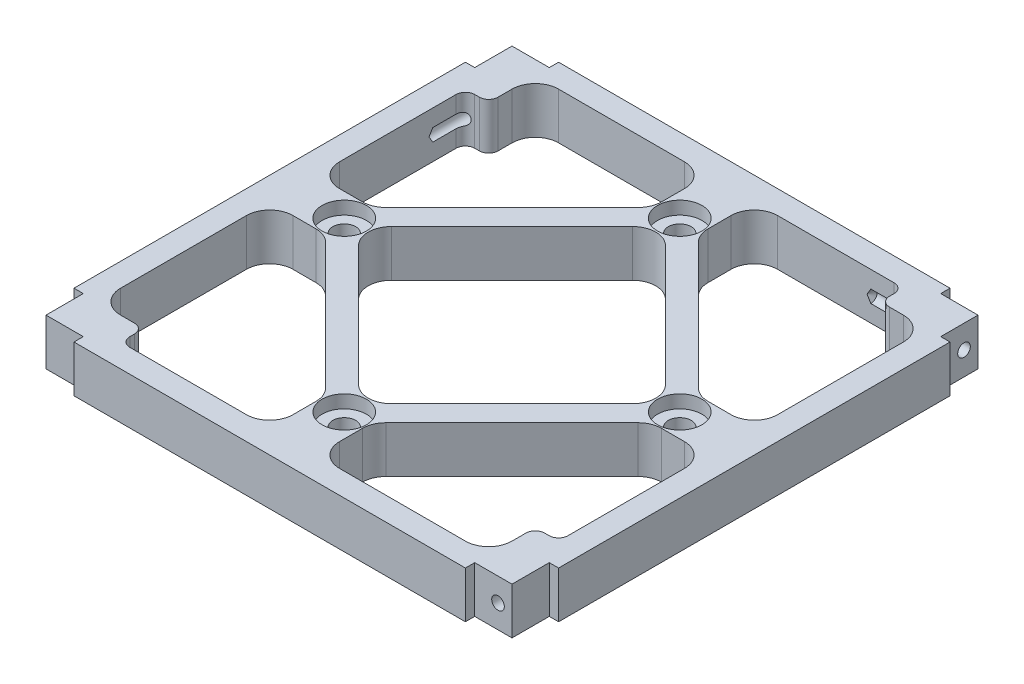
from build123d import *

# Parameters (mm, degrees)
SKETCH1_W                                           = 104
SKETCH1_H                                           = 104
BOSS_EXTRUDE1_DEPTH                                 = 10
FILLET1_R                                           = 5
CUT_EXTRUDE1_DEPTH                                  = 75.215901261
CIRPATTERN1_COUNT                                   = 4
CBORE_FOR_6_BINDING_HEAD_MACHINE_SCREW1_D           = 4.9149
CBORE_FOR_6_BINDING_HEAD_MACHINE_SCREW1_CBORE_D     = 9.525
CBORE_FOR_6_BINDING_HEAD_MACHINE_SCREW1_CBORE_DEPTH = 2.794
FILLET3_R                                           = 2
CIRPATTERN5_COUNT                                   = 4


with BuildPart() as part:
    # Sketch1 → Boss-Extrude1 (new body)
    with BuildSketch(Plane(origin=(0, 0, 0), x_dir=(1, 0, 0), z_dir=(0, 1, 0))):
        Rectangle(SKETCH1_W, SKETCH1_H)
        Polygon((-42, 47), (-42, 37), (-47, 37), (-47, 5), (-35, 5), (-5, 35), (-5, 47), align=None, mode=Mode.SUBTRACT)
        Polygon((-32.928932188, 0), (0, 32.928932188), (32.928932188, 0), (0, -32.928932188), align=None, mode=Mode.SUBTRACT)
        Polygon((5, 47), (5, 35), (35, 5), (47, 5), (47, 42), (37, 42), (37, 47), align=None, mode=Mode.SUBTRACT)
        Polygon((47, -5), (35, -5), (5, -35), (5, -47), (42, -47), (42, -37), (47, -37), align=None, mode=Mode.SUBTRACT)
        Polygon((-5, -47), (-5, -35), (-35, -5), (-47, -5), (-47, -42), (-37, -42), (-37, -47), align=None, mode=Mode.SUBTRACT)
    extrude(amount=BOSS_EXTRUDE1_DEPTH)

    # Fillet1
    fillet1_edges = [part.edges().sort_by_distance(p)[0] for p in [
        (32.928932188, 5, 0),
        (0, 5, 32.928932188),
        (-32.928932188, 5, 0),
        (0, 5, -32.928932188),
        (-5, 5, -47),
        (-5, 5, -35),
        (-35, 5, -5),
        (-47, 5, 42),
        (-47, 5, 5),
        (-35, 5, 5),
        (-5, 5, 35),
        (-5, 5, 47),
        (42, 5, 47),
        (47, 5, 5),
        (35, 5, 5),
        (5, 5, 35),
        (5, 5, 47),
        (47, 5, -42),
        (47, 5, -5),
        (35, 5, -5),
        (5, 5, -35),
        (5, 5, -47),
        (-42, 5, -47),
        (-47, 5, -5),
    ]]
    fillet(fillet1_edges, radius=FILLET1_R)

    # Sketch2 → Cut-Extrude1 (cut, through all)
    with BuildSketch(Plane(origin=(0, 10, 0), x_dir=(1, 0, 0), z_dir=(0, 1, 0))):
        Polygon((-52, 52), (-42, 52), (-42, 50), (-50, 50), (-50, 42), (-52, 42), align=None)
    cut_extrude1 = extrude(amount=-CUT_EXTRUDE1_DEPTH, mode=Mode.SUBTRACT)

    # CirPattern1: Cut-Extrude1 ×4 about axis
    cirpattern1_axis = Axis((0, 10.5, 0), (0, -1, 0))
    for i in range(1, CIRPATTERN1_COUNT):
        add(cut_extrude1.rotate(cirpattern1_axis, i * 360 / CIRPATTERN1_COUNT), mode=Mode.SUBTRACT)

    # CBORE for #6 Binding Head Machine Screw1 (through all)
    with Locations(Plane(origin=(0, 10, 0), x_dir=(1, 0, 0), z_dir=(0, 1, 0))):
        with Locations((0, 36), (-36, 0), (0, -36), (36, 0)):
            CounterBoreHole(CBORE_FOR_6_BINDING_HEAD_MACHINE_SCREW1_D / 2, CBORE_FOR_6_BINDING_HEAD_MACHINE_SCREW1_CBORE_D / 2, CBORE_FOR_6_BINDING_HEAD_MACHINE_SCREW1_CBORE_DEPTH)

    # Fillet3
    fillet3_edges = [part.edges().sort_by_distance(p)[0] for p in [
        (-37, 5, 42),
        (-37, 5, 47),
        (42, 5, 37),
        (47, 5, 37),
        (37, 5, -42),
        (37, 5, -47),
        (-47, 5, -37),
        (-42, 5, -37),
    ]]
    fillet(fillet3_edges, radius=FILLET3_R)

    # Sketch9 → #6-32 Tapped Hole1 (revolve, cut)
    with BuildSketch(Plane(origin=(50, 5, -47), x_dir=(0, 0, -1), z_dir=(0, 1, 0))):
        Polygon((0, 0), (0, 20.81269403), (1.35255, 20), (1.35255, 0), align=None)
    f_6_32_tapped_hole1 = revolve(axis=Axis((56.35, 5, -47), (-1, 0, 0)), mode=Mode.SUBTRACT)

    # CirPattern5: #6-32 Tapped Hole1 ×4 about axis
    cirpattern5_axis = Axis((0, 10.5, 0), (0, -1, 0))
    for i in range(1, CIRPATTERN5_COUNT):
        add(f_6_32_tapped_hole1.rotate(cirpattern5_axis, i * 360 / CIRPATTERN5_COUNT), mode=Mode.SUBTRACT)


solid = part.part
